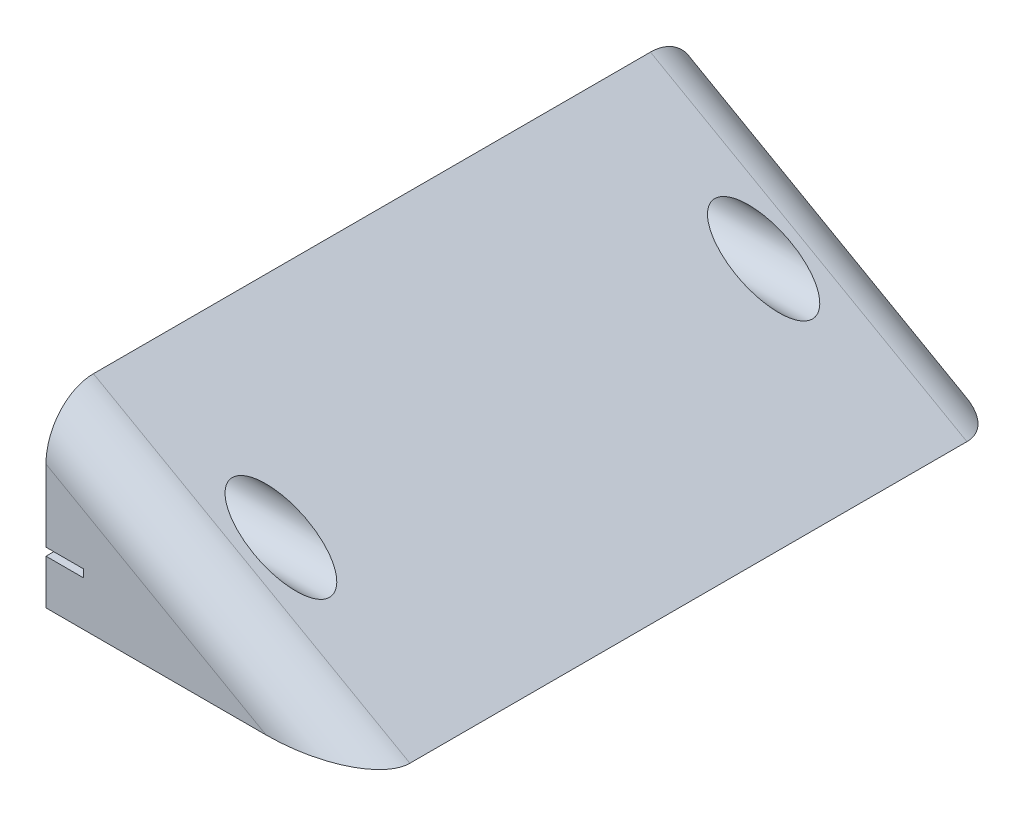
from build123d import *

# Parameters (mm, degrees)
BOSS_EXTRUDE1_DEPTH = 261.62
SKETCH3_R           = 11.049
SKETCH3_R_2         = 11.103550021
CUT_EXTRUDE2_DEPTH  = 109.728
SKETCH2_W           = 14.986
SKETCH2_H           = 3.124293054
CUT_EXTRUDE3_DEPTH  = 268.224
VARFILLET1_START    = -36
VARFILLET1_DEPTH    = 148


with BuildPart() as part:
    # Sketch1 → Boss-Extrude1 (new body)
    with BuildSketch(Plane.XY):
        Polygon((0, 0), (0, 71.882), (127, 0), align=None)
    extrude(amount=BOSS_EXTRUDE1_DEPTH)

    # Sketch3 → Cut-Extrude2 (cut)
    with BuildSketch(Plane.ZY):
        with Locations((227.711, 37.719)):
            Circle(SKETCH3_R)
        with Locations((34.001176145, 37.719)):
            Circle(SKETCH3_R_2)
    extrude(amount=-CUT_EXTRUDE2_DEPTH, mode=Mode.SUBTRACT)

    # Sketch2 → Cut-Extrude3 (cut)
    with BuildSketch(Plane.XY.offset(261.62)):
        with Locations((7.493, 19.538461467)):
            Rectangle(SKETCH2_W, SKETCH2_H)
    extrude(amount=-CUT_EXTRUDE3_DEPTH, mode=Mode.SUBTRACT)

    # VarFillet1: read off the stored shape, not the designer's step
    # VarFillet1 outline → VarFillet1 (cut)
    with BuildSketch(Plane(origin=(0, 0, 0), x_dir=(0.4925733480628631, 0.8702709329732561, 0), z_dir=(0.8702709329732561, -0.49257334806286307, 0)).offset(VARFILLET1_START)):
        with BuildLine():
            Line((62.556815204, 0), (62.556815204, 19.05))
            ThreePointArc((62.556815204, 19.05), (56.977199386, 5.579615818), (43.506815204, 0))
            Line((43.506815204, 0), (62.556815204, 0))
        make_face()
        with BuildLine():
            ThreePointArc((43.506815204, 261.62), (56.977199386, 256.040384182), (62.556815204, 242.57))
            Line((62.556815204, 242.57), (62.556815204, 261.62))
            Line((62.556815204, 261.62), (43.506815204, 261.62))
        make_face()
    extrude(amount=VARFILLET1_DEPTH, mode=Mode.SUBTRACT)


solid = part.part
